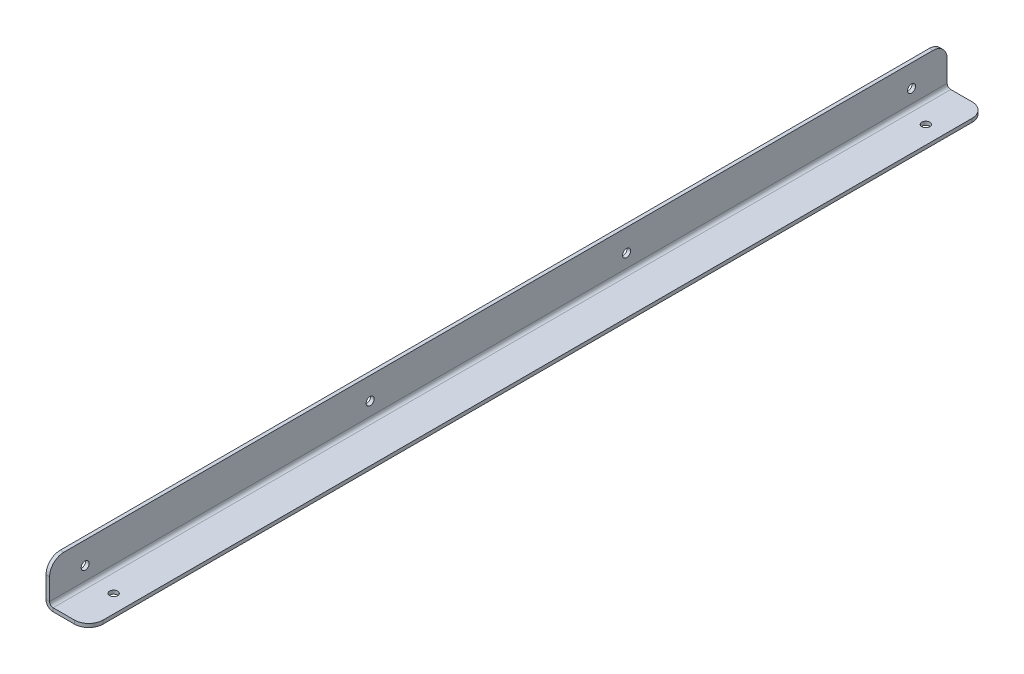
from build123d import *

# Parameters (mm, degrees)
BASE_FLANGE1_DEPTH              = 800.1
FILLET1_R                       = 12.7
F_9_32_0_28125_DIAMETER_HOLE1_D = 7.14375
F_9_32_0_28125_DIAMETER_HOLE2_D = 7.14375


# Sheet-metal steps are written as plain solids
with BuildPart() as part:
    # Sketch1 → Base-Flange1 (new body)
    with BuildSketch(Plane.XY):
        with BuildLine():
            Line((0, 38.1), (0, 6.35))
            ThreePointArc((0, 6.35), (1.859871939, 1.859871939), (6.35, 0))
            Line((6.35, 0), (38.1, 0))
            Line((38.1, 0), (38.1, 3.175))
            Line((38.1, 3.175), (6.35, 3.175))
            ThreePointArc((6.35, 3.175), (4.10493597, 4.10493597), (3.175, 6.35))
            Line((3.175, 6.35), (3.175, 38.1))
            Line((3.175, 38.1), (0, 38.1))
        make_face()
    extrude(amount=BASE_FLANGE1_DEPTH)

    # Fillet1
    fillet1_edges = [part.edges().sort_by_distance(p)[0] for p in [
        (1.5875, 38.1, 800.1),
        (1.5875, 38.1, 0),
        (38.1, 1.5875, 800.1),
        (38.1, 1.5875, 0),
    ]]
    fillet(fillet1_edges, radius=FILLET1_R)

    # 9/32 (0.28125) Diameter Hole1 (through all)
    with Locations(Plane(origin=(3.175, 0, 0), x_dir=(0, 0, -1), z_dir=(1, 0, 0))):
        with Locations((-768.35, 18.25625), (-514.35, 18.25625), (-285.75, 18.25625), (-31.75, 18.25625)):
            Hole(F_9_32_0_28125_DIAMETER_HOLE1_D / 2)

    # 9/32 (0.28125) Diameter Hole2 (through all)
    with Locations(Plane(origin=(0, 3.175, 0), x_dir=(1, 0, 0), z_dir=(0, 1, 0))):
        with Locations((22.225, -38.1), (22.225, -762)):
            Hole(F_9_32_0_28125_DIAMETER_HOLE2_D / 2)


solid = part.part
